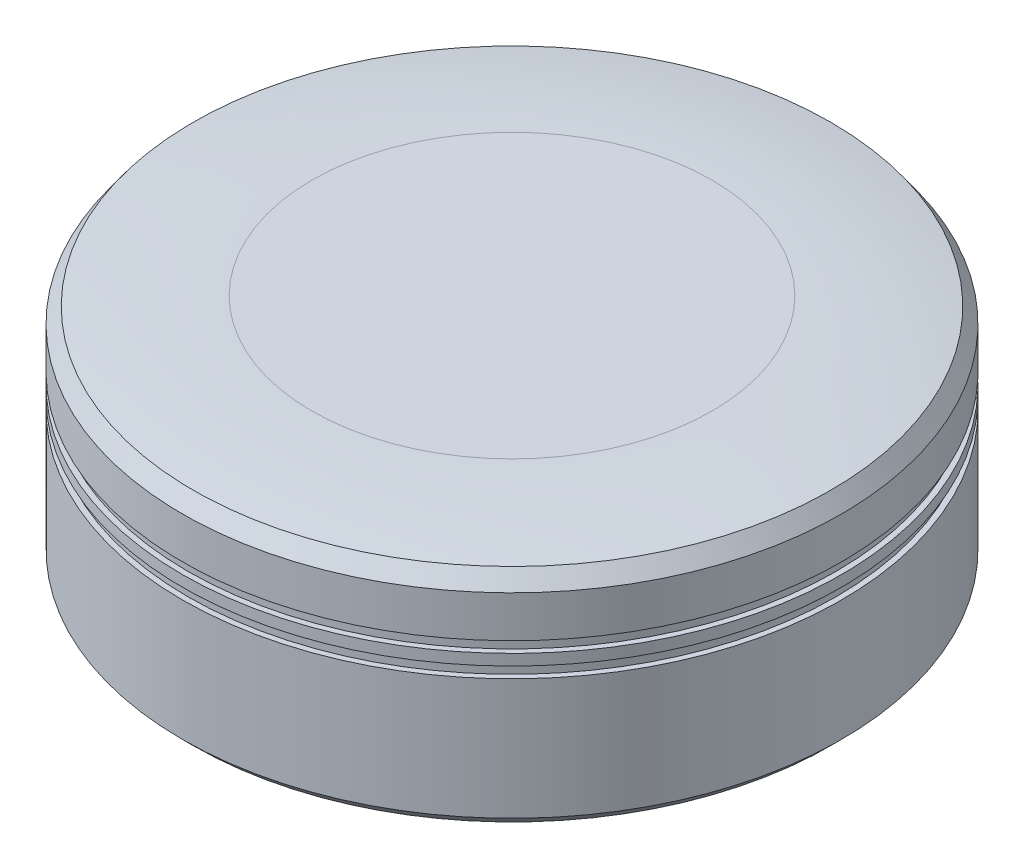
from build123d import *

# Parameters (mm, degrees)
SKETCH1_R               = 15
BOSS_EXTRUDE1_DEPTH     = 12
SKETCH2_R               = 2.95
CUT_EXTRUDE1_DEPTH      = 9.8
SKETCH3_W               = 0.578198398
SKETCH3_H               = 0.5
CHAMFER1_SIZE           = 0.5
FILLET1_R               = 35
CHAMFER3_SIZE           = 0.611779298
CUT_EXTRUDE2_DEPTH      = 25.372115214
CUT_EXTRUDE2_DEPTH_BACK = 25.372115214
SKETCH5_W               = 30
SKETCH5_H               = 1.5
CHAMFER4_SIZE           = 0.5


with BuildPart() as part:
    # Sketch1 → Boss-Extrude1 (new body)
    with BuildSketch(Plane(origin=(0, 0, 0), x_dir=(1, 0, 0), z_dir=(0, 1, 0))):
        with Locations(Location((0, 0, 0), (0, 0, 270))):
            Circle(SKETCH1_R)
    extrude(amount=BOSS_EXTRUDE1_DEPTH)

    # Sketch2 → Cut-Extrude1 (cut)
    with BuildSketch(Plane.XZ):
        with Locations(Location((0, 0, 0), (0, 0, 270))):
            Circle(SKETCH2_R)
    extrude(amount=-CUT_EXTRUDE1_DEPTH, mode=Mode.SUBTRACT)

    # Sketch3 → Cut-Revolve1 (revolve, cut)
    with BuildSketch(Plane.XY, mode=Mode.PRIVATE) as cut_revolve1_sk:
        with Locations((15.039099199, 8.75)):
            Rectangle(SKETCH3_W, SKETCH3_H)
        with Locations((15.039099199, 7.75)):
            Rectangle(SKETCH3_W, SKETCH3_H)
    revolve(cut_revolve1_sk.sketch.rotate(Axis((0, 13.00080105, 0), (0, -1, 0)), 90), axis=Axis((0, 13.00080105, 0), (0, -1, 0)), mode=Mode.SUBTRACT)

    # Chamfer1
    chamfer1_edges = [part.edges().sort_by_distance(p)[0] for p in [
        (0, 12, -15),
    ]]
    chamfer(chamfer1_edges, length=CHAMFER1_SIZE)

    # Fillet1
    # the kernel refuses this fillet: 35 mm, written as the material it takes off along each edge
    with BuildSketch(Plane(origin=(0, 12, 0), x_dir=(0, 0, 1), z_dir=(-1, 0, 0))) as fillet1_piece_1:
        with BuildLine():
            CenterArc((9.105086939, -35), FILLET1_R, 80.303678946, 9.696321054)
            Line((9.105086939, 0), (9.105086939, 0.7))
            Line((9.105086939, 0.7), (14.5, 0.7))
            Line((14.5, 0.7), (14.994974747, 0.494974747))
            ThreePointArc((14.994974747, 0.494974747), (15.244974747, 0.244974747), (15.117898261, 0.19))
            Line((15.117898261, 0.19), (15, -0.5))
        make_face()
    revolve(axis=Axis((0, 12, 0), (0, 1, 0)), mode=Mode.SUBTRACT)

    # Chamfer3
    # the kernel refuses this chamfer: 0.611779298, 0.5 mm, written as the material it takes off along each edge
    with BuildSketch(Plane(origin=(0, 11.5, 0), x_dir=(0, 0, 1), z_dir=(-1, 0, 0))) as chamfer3_piece_1:
        with BuildLine():
            Line((15, -CHAMFER3_SIZE), (14.510020918, 0.080148766))
            ThreePointArc((14.510020918, 0.080148766), (14.746676693, 0.042328599), (15, 0))
            Line((15, 0), (15, -CHAMFER3_SIZE))
        make_face()
    revolve(axis=Axis((0, 11.5, 0), (0, 1, 0)), mode=Mode.SUBTRACT)

    # Sketch5 → Cut-Extrude2 (cut, two sides: drawn at the far end of the back side and taken through both)
    with BuildSketch(Plane.XY.offset(-CUT_EXTRUDE2_DEPTH_BACK)):
        with Locations((0, 0.75)):
            Rectangle(SKETCH5_W, SKETCH5_H)
    extrude(amount=CUT_EXTRUDE2_DEPTH + CUT_EXTRUDE2_DEPTH_BACK, mode=Mode.SUBTRACT)

    # Chamfer4
    chamfer4_edges = [part.edges().sort_by_distance(p)[0] for p in [
        (0, 1.5, -15),
    ]]
    chamfer(chamfer4_edges, length=CHAMFER4_SIZE)


solid = part.part
